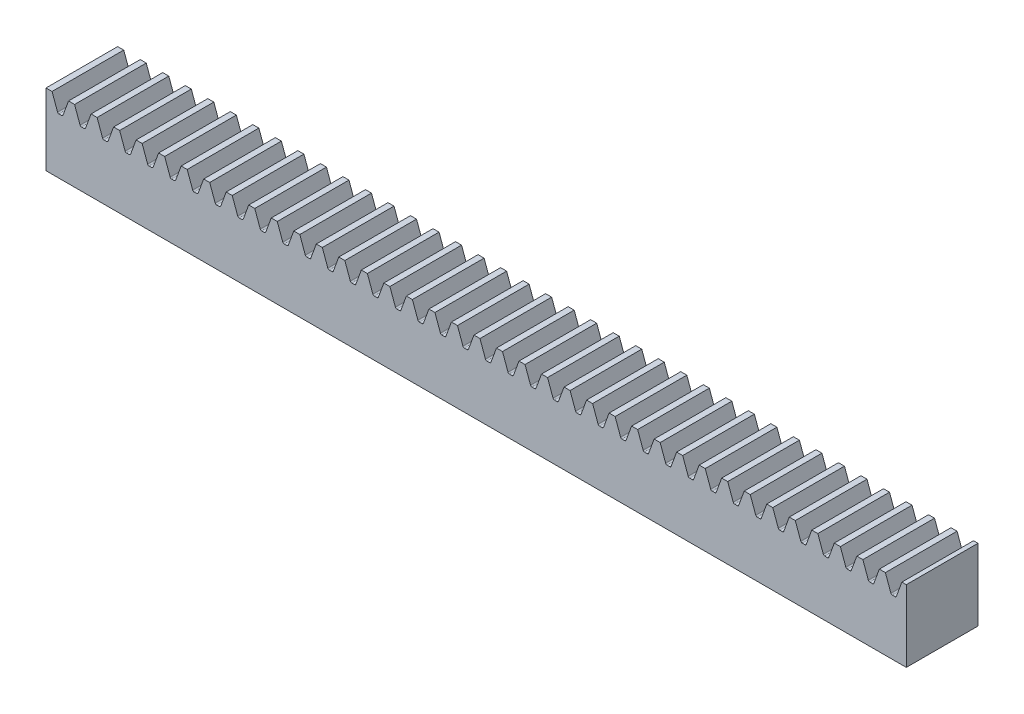
from build123d import *

# Parameters (mm, degrees)
SKETCH1_W           = 152.4
SKETCH1_H           = 12.7
BOSS_EXTRUDE1_DEPTH = 6.35
CUT_EXTRUDE1_DEPTH  = 12.7
FILLET3_R           = 0.254566605
LPATTERN4_START     = -6.35
LPATTERN4_DEPTH     = 12.7


# Read off the part's stored shape, not the designer's step: LPattern4
with BuildPart() as part:
    # Sketch1 → Boss-Extrude1 (new, symmetric)
    with BuildSketch(Plane.XY):
        Rectangle(SKETCH1_W, SKETCH1_H)
    extrude(amount=BOSS_EXTRUDE1_DEPTH, both=True)

    # Sketch2 → Cut-Extrude1 (cut)
    with BuildSketch(Plane.XY.offset(6.35)):
        Polygon((-75.129568395, 6.35), (-74.094145873, 3.5052), (-73.245590522, 3.5052), (-72.210168, 6.35), align=None)
    extrude(amount=-CUT_EXTRUDE1_DEPTH, mode=Mode.SUBTRACT)

    # Fillet3
    fillet3_edges = [part.edges().sort_by_distance(p)[0] for p in [
        (-73.245590522, 3.5052, 0),
        (-74.094145873, 3.5052, 0),
    ]]
    fillet(fillet3_edges, radius=FILLET3_R)

    # LPattern4 outline → LPattern4 (cut)
    with BuildSketch(Plane.XY.offset(LPATTERN4_START)):
        with BuildLine():
            ThreePointArc((-70.165278777, 3.672699698), (-70.072077823, 3.55123785), (-69.926064417, 3.5052))
            Line((-69.926064417, 3.5052), (-69.434007978, 3.5052))
            ThreePointArc((-69.434007978, 3.5052), (-69.287994572, 3.55123785), (-69.194793618, 3.672699698))
            Line((-69.194793618, 3.672699698), (-68.220336, 6.35))
            Line((-68.220336, 6.35), (-71.139736395, 6.35))
            Line((-71.139736395, 6.35), (-70.165278777, 3.672699698))
        make_face()
        with BuildLine():
            Line((75.413616, 6.35), (72.494215605, 6.35))
            Line((72.494215605, 6.35), (73.468673223, 3.672699698))
            ThreePointArc((73.468673223, 3.672699698), (73.561874177, 3.55123785), (73.707887583, 3.5052))
            Line((73.707887583, 3.5052), (74.199944022, 3.5052))
            ThreePointArc((74.199944022, 3.5052), (74.345957428, 3.55123785), (74.439158382, 3.672699698))
            Line((74.439158382, 3.672699698), (75.413616, 6.35))
        make_face()
        with BuildLine():
            Line((71.423784, 6.35), (68.504383605, 6.35))
            Line((68.504383605, 6.35), (69.478841223, 3.672699698))
            ThreePointArc((69.478841223, 3.672699698), (69.572042177, 3.55123785), (69.718055583, 3.5052))
            Line((69.718055583, 3.5052), (70.210112022, 3.5052))
            ThreePointArc((70.210112022, 3.5052), (70.356125428, 3.55123785), (70.449326382, 3.672699698))
            Line((70.449326382, 3.672699698), (71.423784, 6.35))
        make_face()
        with BuildLine():
            Line((67.433952, 6.35), (64.514551605, 6.35))
            Line((64.514551605, 6.35), (65.489009223, 3.672699698))
            ThreePointArc((65.489009223, 3.672699698), (65.582210177, 3.55123785), (65.728223583, 3.5052))
            Line((65.728223583, 3.5052), (66.220280022, 3.5052))
            ThreePointArc((66.220280022, 3.5052), (66.366293428, 3.55123785), (66.459494382, 3.672699698))
            Line((66.459494382, 3.672699698), (67.433952, 6.35))
        make_face()
        with BuildLine():
            Line((63.44412, 6.35), (60.524719605, 6.35))
            Line((60.524719605, 6.35), (61.499177223, 3.672699698))
            ThreePointArc((61.499177223, 3.672699698), (61.592378177, 3.55123785), (61.738391583, 3.5052))
            Line((61.738391583, 3.5052), (62.230448022, 3.5052))
            ThreePointArc((62.230448022, 3.5052), (62.376461428, 3.55123785), (62.469662382, 3.672699698))
            Line((62.469662382, 3.672699698), (63.44412, 6.35))
        make_face()
        with BuildLine():
            Line((59.454288, 6.35), (56.534887605, 6.35))
            Line((56.534887605, 6.35), (57.509345223, 3.672699698))
            ThreePointArc((57.509345223, 3.672699698), (57.602546177, 3.55123785), (57.748559583, 3.5052))
            Line((57.748559583, 3.5052), (58.240616022, 3.5052))
            ThreePointArc((58.240616022, 3.5052), (58.386629428, 3.55123785), (58.479830382, 3.672699698))
            Line((58.479830382, 3.672699698), (59.454288, 6.35))
        make_face()
        with BuildLine():
            Line((55.464456, 6.35), (52.545055605, 6.35))
            Line((52.545055605, 6.35), (53.519513223, 3.672699698))
            ThreePointArc((53.519513223, 3.672699698), (53.612714177, 3.55123785), (53.758727583, 3.5052))
            Line((53.758727583, 3.5052), (54.250784022, 3.5052))
            ThreePointArc((54.250784022, 3.5052), (54.396797428, 3.55123785), (54.489998382, 3.672699698))
            Line((54.489998382, 3.672699698), (55.464456, 6.35))
        make_face()
        with BuildLine():
            Line((51.474624, 6.35), (48.555223605, 6.35))
            Line((48.555223605, 6.35), (49.529681223, 3.672699698))
            ThreePointArc((49.529681223, 3.672699698), (49.622882177, 3.55123785), (49.768895583, 3.5052))
            Line((49.768895583, 3.5052), (50.260952022, 3.5052))
            ThreePointArc((50.260952022, 3.5052), (50.406965428, 3.55123785), (50.500166382, 3.672699698))
            Line((50.500166382, 3.672699698), (51.474624, 6.35))
        make_face()
        with BuildLine():
            Line((47.484792, 6.35), (44.565391605, 6.35))
            Line((44.565391605, 6.35), (45.539849223, 3.672699698))
            ThreePointArc((45.539849223, 3.672699698), (45.633050177, 3.55123785), (45.779063583, 3.5052))
            Line((45.779063583, 3.5052), (46.271120022, 3.5052))
            ThreePointArc((46.271120022, 3.5052), (46.417133428, 3.55123785), (46.510334382, 3.672699698))
            Line((46.510334382, 3.672699698), (47.484792, 6.35))
        make_face()
        with BuildLine():
            Line((43.49496, 6.35), (40.575559605, 6.35))
            Line((40.575559605, 6.35), (41.550017223, 3.672699698))
            ThreePointArc((41.550017223, 3.672699698), (41.643218177, 3.55123785), (41.789231583, 3.5052))
            Line((41.789231583, 3.5052), (42.281288022, 3.5052))
            ThreePointArc((42.281288022, 3.5052), (42.427301428, 3.55123785), (42.520502382, 3.672699698))
            Line((42.520502382, 3.672699698), (43.49496, 6.35))
        make_face()
        with BuildLine():
            Line((39.505128, 6.35), (36.585727605, 6.35))
            Line((36.585727605, 6.35), (37.560185223, 3.672699698))
            ThreePointArc((37.560185223, 3.672699698), (37.653386177, 3.55123785), (37.799399583, 3.5052))
            Line((37.799399583, 3.5052), (38.291456022, 3.5052))
            ThreePointArc((38.291456022, 3.5052), (38.437469428, 3.55123785), (38.530670382, 3.672699698))
            Line((38.530670382, 3.672699698), (39.505128, 6.35))
        make_face()
        with BuildLine():
            Line((35.515296, 6.35), (32.595895605, 6.35))
            Line((32.595895605, 6.35), (33.570353223, 3.672699698))
            ThreePointArc((33.570353223, 3.672699698), (33.663554177, 3.55123785), (33.809567583, 3.5052))
            Line((33.809567583, 3.5052), (34.301624022, 3.5052))
            ThreePointArc((34.301624022, 3.5052), (34.447637428, 3.55123785), (34.540838382, 3.672699698))
            Line((34.540838382, 3.672699698), (35.515296, 6.35))
        make_face()
        with BuildLine():
            Line((31.525464, 6.35), (28.606063605, 6.35))
            Line((28.606063605, 6.35), (29.580521223, 3.672699698))
            ThreePointArc((29.580521223, 3.672699698), (29.673722177, 3.55123785), (29.819735583, 3.5052))
            Line((29.819735583, 3.5052), (30.311792022, 3.5052))
            ThreePointArc((30.311792022, 3.5052), (30.457805428, 3.55123785), (30.551006382, 3.672699698))
            Line((30.551006382, 3.672699698), (31.525464, 6.35))
        make_face()
        with BuildLine():
            Line((27.535632, 6.35), (24.616231605, 6.35))
            Line((24.616231605, 6.35), (25.590689223, 3.672699698))
            ThreePointArc((25.590689223, 3.672699698), (25.683890177, 3.55123785), (25.829903583, 3.5052))
            Line((25.829903583, 3.5052), (26.321960022, 3.5052))
            ThreePointArc((26.321960022, 3.5052), (26.467973428, 3.55123785), (26.561174382, 3.672699698))
            Line((26.561174382, 3.672699698), (27.535632, 6.35))
        make_face()
        with BuildLine():
            Line((23.5458, 6.35), (20.626399605, 6.35))
            Line((20.626399605, 6.35), (21.600857223, 3.672699698))
            ThreePointArc((21.600857223, 3.672699698), (21.694058177, 3.55123785), (21.840071583, 3.5052))
            Line((21.840071583, 3.5052), (22.332128022, 3.5052))
            ThreePointArc((22.332128022, 3.5052), (22.478141428, 3.55123785), (22.571342382, 3.672699698))
            Line((22.571342382, 3.672699698), (23.5458, 6.35))
        make_face()
        with BuildLine():
            Line((19.555968, 6.35), (16.636567605, 6.35))
            Line((16.636567605, 6.35), (17.611025223, 3.672699698))
            ThreePointArc((17.611025223, 3.672699698), (17.704226177, 3.55123785), (17.850239583, 3.5052))
            Line((17.850239583, 3.5052), (18.342296022, 3.5052))
            ThreePointArc((18.342296022, 3.5052), (18.488309428, 3.55123785), (18.581510382, 3.672699698))
            Line((18.581510382, 3.672699698), (19.555968, 6.35))
        make_face()
        with BuildLine():
            Line((15.566136, 6.35), (12.646735605, 6.35))
            Line((12.646735605, 6.35), (13.621193223, 3.672699698))
            ThreePointArc((13.621193223, 3.672699698), (13.714394177, 3.55123785), (13.860407583, 3.5052))
            Line((13.860407583, 3.5052), (14.352464022, 3.5052))
            ThreePointArc((14.352464022, 3.5052), (14.498477428, 3.55123785), (14.591678382, 3.672699698))
            Line((14.591678382, 3.672699698), (15.566136, 6.35))
        make_face()
        with BuildLine():
            Line((11.576304, 6.35), (8.656903605, 6.35))
            Line((8.656903605, 6.35), (9.631361223, 3.672699698))
            ThreePointArc((9.631361223, 3.672699698), (9.724562177, 3.55123785), (9.870575583, 3.5052))
            Line((9.870575583, 3.5052), (10.362632022, 3.5052))
            ThreePointArc((10.362632022, 3.5052), (10.508645428, 3.55123785), (10.601846382, 3.672699698))
            Line((10.601846382, 3.672699698), (11.576304, 6.35))
        make_face()
        with BuildLine():
            Line((7.586472, 6.35), (4.667071605, 6.35))
            Line((4.667071605, 6.35), (5.641529223, 3.672699698))
            ThreePointArc((5.641529223, 3.672699698), (5.734730177, 3.55123785), (5.880743583, 3.5052))
            Line((5.880743583, 3.5052), (6.372800022, 3.5052))
            ThreePointArc((6.372800022, 3.5052), (6.518813428, 3.55123785), (6.612014382, 3.672699698))
            Line((6.612014382, 3.672699698), (7.586472, 6.35))
        make_face()
        with BuildLine():
            Line((3.59664, 6.35), (0.677239605, 6.35))
            Line((0.677239605, 6.35), (1.651697223, 3.672699698))
            ThreePointArc((1.651697223, 3.672699698), (1.744898177, 3.55123785), (1.890911583, 3.5052))
            Line((1.890911583, 3.5052), (2.382968022, 3.5052))
            ThreePointArc((2.382968022, 3.5052), (2.528981428, 3.55123785), (2.622182382, 3.672699698))
            Line((2.622182382, 3.672699698), (3.59664, 6.35))
        make_face()
        with BuildLine():
            Line((-0.393192, 6.35), (-3.312592395, 6.35))
            Line((-3.312592395, 6.35), (-2.338134777, 3.672699698))
            ThreePointArc((-2.338134777, 3.672699698), (-2.244933823, 3.55123785), (-2.098920417, 3.5052))
            Line((-2.098920417, 3.5052), (-1.606863978, 3.5052))
            ThreePointArc((-1.606863978, 3.5052), (-1.460850572, 3.55123785), (-1.367649618, 3.672699698))
            Line((-1.367649618, 3.672699698), (-0.393192, 6.35))
        make_face()
        with BuildLine():
            Line((-4.383024, 6.35), (-7.302424395, 6.35))
            Line((-7.302424395, 6.35), (-6.327966777, 3.672699698))
            ThreePointArc((-6.327966777, 3.672699698), (-6.234765823, 3.55123785), (-6.088752417, 3.5052))
            Line((-6.088752417, 3.5052), (-5.596695978, 3.5052))
            ThreePointArc((-5.596695978, 3.5052), (-5.450682572, 3.55123785), (-5.357481618, 3.672699698))
            Line((-5.357481618, 3.672699698), (-4.383024, 6.35))
        make_face()
        with BuildLine():
            Line((-8.372856, 6.35), (-11.292256395, 6.35))
            Line((-11.292256395, 6.35), (-10.317798777, 3.672699698))
            ThreePointArc((-10.317798777, 3.672699698), (-10.224597823, 3.55123785), (-10.078584417, 3.5052))
            Line((-10.078584417, 3.5052), (-9.586527978, 3.5052))
            ThreePointArc((-9.586527978, 3.5052), (-9.440514572, 3.55123785), (-9.347313618, 3.672699698))
            Line((-9.347313618, 3.672699698), (-8.372856, 6.35))
        make_face()
        with BuildLine():
            Line((-12.362688, 6.35), (-15.282088395, 6.35))
            Line((-15.282088395, 6.35), (-14.307630777, 3.672699698))
            ThreePointArc((-14.307630777, 3.672699698), (-14.214429823, 3.55123785), (-14.068416417, 3.5052))
            Line((-14.068416417, 3.5052), (-13.576359978, 3.5052))
            ThreePointArc((-13.576359978, 3.5052), (-13.430346572, 3.55123785), (-13.337145618, 3.672699698))
            Line((-13.337145618, 3.672699698), (-12.362688, 6.35))
        make_face()
        with BuildLine():
            Line((-16.35252, 6.35), (-19.271920395, 6.35))
            Line((-19.271920395, 6.35), (-18.297462777, 3.672699698))
            ThreePointArc((-18.297462777, 3.672699698), (-18.204261823, 3.55123785), (-18.058248417, 3.5052))
            Line((-18.058248417, 3.5052), (-17.566191978, 3.5052))
            ThreePointArc((-17.566191978, 3.5052), (-17.420178572, 3.55123785), (-17.326977618, 3.672699698))
            Line((-17.326977618, 3.672699698), (-16.35252, 6.35))
        make_face()
        with BuildLine():
            Line((-20.342352, 6.35), (-23.261752395, 6.35))
            Line((-23.261752395, 6.35), (-22.287294777, 3.672699698))
            ThreePointArc((-22.287294777, 3.672699698), (-22.194093823, 3.55123785), (-22.048080417, 3.5052))
            Line((-22.048080417, 3.5052), (-21.556023978, 3.5052))
            ThreePointArc((-21.556023978, 3.5052), (-21.410010572, 3.55123785), (-21.316809618, 3.672699698))
            Line((-21.316809618, 3.672699698), (-20.342352, 6.35))
        make_face()
        with BuildLine():
            Line((-24.332184, 6.35), (-27.251584395, 6.35))
            Line((-27.251584395, 6.35), (-26.277126777, 3.672699698))
            ThreePointArc((-26.277126777, 3.672699698), (-26.183925823, 3.55123785), (-26.037912417, 3.5052))
            Line((-26.037912417, 3.5052), (-25.545855978, 3.5052))
            ThreePointArc((-25.545855978, 3.5052), (-25.399842572, 3.55123785), (-25.306641618, 3.672699698))
            Line((-25.306641618, 3.672699698), (-24.332184, 6.35))
        make_face()
        with BuildLine():
            Line((-28.322016, 6.35), (-31.241416395, 6.35))
            Line((-31.241416395, 6.35), (-30.266958777, 3.672699698))
            ThreePointArc((-30.266958777, 3.672699698), (-30.173757823, 3.55123785), (-30.027744417, 3.5052))
            Line((-30.027744417, 3.5052), (-29.535687978, 3.5052))
            ThreePointArc((-29.535687978, 3.5052), (-29.389674572, 3.55123785), (-29.296473618, 3.672699698))
            Line((-29.296473618, 3.672699698), (-28.322016, 6.35))
        make_face()
        with BuildLine():
            Line((-32.311848, 6.35), (-35.231248395, 6.35))
            Line((-35.231248395, 6.35), (-34.256790777, 3.672699698))
            ThreePointArc((-34.256790777, 3.672699698), (-34.163589823, 3.55123785), (-34.017576417, 3.5052))
            Line((-34.017576417, 3.5052), (-33.525519978, 3.5052))
            ThreePointArc((-33.525519978, 3.5052), (-33.379506572, 3.55123785), (-33.286305618, 3.672699698))
            Line((-33.286305618, 3.672699698), (-32.311848, 6.35))
        make_face()
        with BuildLine():
            Line((-36.30168, 6.35), (-39.221080395, 6.35))
            Line((-39.221080395, 6.35), (-38.246622777, 3.672699698))
            ThreePointArc((-38.246622777, 3.672699698), (-38.153421823, 3.55123785), (-38.007408417, 3.5052))
            Line((-38.007408417, 3.5052), (-37.515351978, 3.5052))
            ThreePointArc((-37.515351978, 3.5052), (-37.369338572, 3.55123785), (-37.276137618, 3.672699698))
            Line((-37.276137618, 3.672699698), (-36.30168, 6.35))
        make_face()
        with BuildLine():
            Line((-40.291512, 6.35), (-43.210912395, 6.35))
            Line((-43.210912395, 6.35), (-42.236454777, 3.672699698))
            ThreePointArc((-42.236454777, 3.672699698), (-42.143253823, 3.55123785), (-41.997240417, 3.5052))
            Line((-41.997240417, 3.5052), (-41.505183978, 3.5052))
            ThreePointArc((-41.505183978, 3.5052), (-41.359170572, 3.55123785), (-41.265969618, 3.672699698))
            Line((-41.265969618, 3.672699698), (-40.291512, 6.35))
        make_face()
        with BuildLine():
            Line((-44.281344, 6.35), (-47.200744395, 6.35))
            Line((-47.200744395, 6.35), (-46.226286777, 3.672699698))
            ThreePointArc((-46.226286777, 3.672699698), (-46.133085823, 3.55123785), (-45.987072417, 3.5052))
            Line((-45.987072417, 3.5052), (-45.495015978, 3.5052))
            ThreePointArc((-45.495015978, 3.5052), (-45.349002572, 3.55123785), (-45.255801618, 3.672699698))
            Line((-45.255801618, 3.672699698), (-44.281344, 6.35))
        make_face()
        with BuildLine():
            Line((-48.271176, 6.35), (-51.190576395, 6.35))
            Line((-51.190576395, 6.35), (-50.216118777, 3.672699698))
            ThreePointArc((-50.216118777, 3.672699698), (-50.122917823, 3.55123785), (-49.976904417, 3.5052))
            Line((-49.976904417, 3.5052), (-49.484847978, 3.5052))
            ThreePointArc((-49.484847978, 3.5052), (-49.338834572, 3.55123785), (-49.245633618, 3.672699698))
            Line((-49.245633618, 3.672699698), (-48.271176, 6.35))
        make_face()
        with BuildLine():
            Line((-52.261008, 6.35), (-55.180408395, 6.35))
            Line((-55.180408395, 6.35), (-54.205950777, 3.672699698))
            ThreePointArc((-54.205950777, 3.672699698), (-54.112749823, 3.55123785), (-53.966736417, 3.5052))
            Line((-53.966736417, 3.5052), (-53.474679978, 3.5052))
            ThreePointArc((-53.474679978, 3.5052), (-53.328666572, 3.55123785), (-53.235465618, 3.672699698))
            Line((-53.235465618, 3.672699698), (-52.261008, 6.35))
        make_face()
        with BuildLine():
            Line((-56.25084, 6.35), (-59.170240395, 6.35))
            Line((-59.170240395, 6.35), (-58.195782777, 3.672699698))
            ThreePointArc((-58.195782777, 3.672699698), (-58.102581823, 3.55123785), (-57.956568417, 3.5052))
            Line((-57.956568417, 3.5052), (-57.464511978, 3.5052))
            ThreePointArc((-57.464511978, 3.5052), (-57.318498572, 3.55123785), (-57.225297618, 3.672699698))
            Line((-57.225297618, 3.672699698), (-56.25084, 6.35))
        make_face()
        with BuildLine():
            Line((-60.240672, 6.35), (-63.160072395, 6.35))
            Line((-63.160072395, 6.35), (-62.185614777, 3.672699698))
            ThreePointArc((-62.185614777, 3.672699698), (-62.092413823, 3.55123785), (-61.946400417, 3.5052))
            Line((-61.946400417, 3.5052), (-61.454343978, 3.5052))
            ThreePointArc((-61.454343978, 3.5052), (-61.308330572, 3.55123785), (-61.215129618, 3.672699698))
            Line((-61.215129618, 3.672699698), (-60.240672, 6.35))
        make_face()
        with BuildLine():
            Line((-64.230504, 6.35), (-67.149904395, 6.35))
            Line((-67.149904395, 6.35), (-66.175446777, 3.672699698))
            ThreePointArc((-66.175446777, 3.672699698), (-66.082245823, 3.55123785), (-65.936232417, 3.5052))
            Line((-65.936232417, 3.5052), (-65.444175978, 3.5052))
            ThreePointArc((-65.444175978, 3.5052), (-65.298162572, 3.55123785), (-65.204961618, 3.672699698))
            Line((-65.204961618, 3.672699698), (-64.230504, 6.35))
        make_face()
    extrude(amount=LPATTERN4_DEPTH, mode=Mode.SUBTRACT)


solid = part.part
